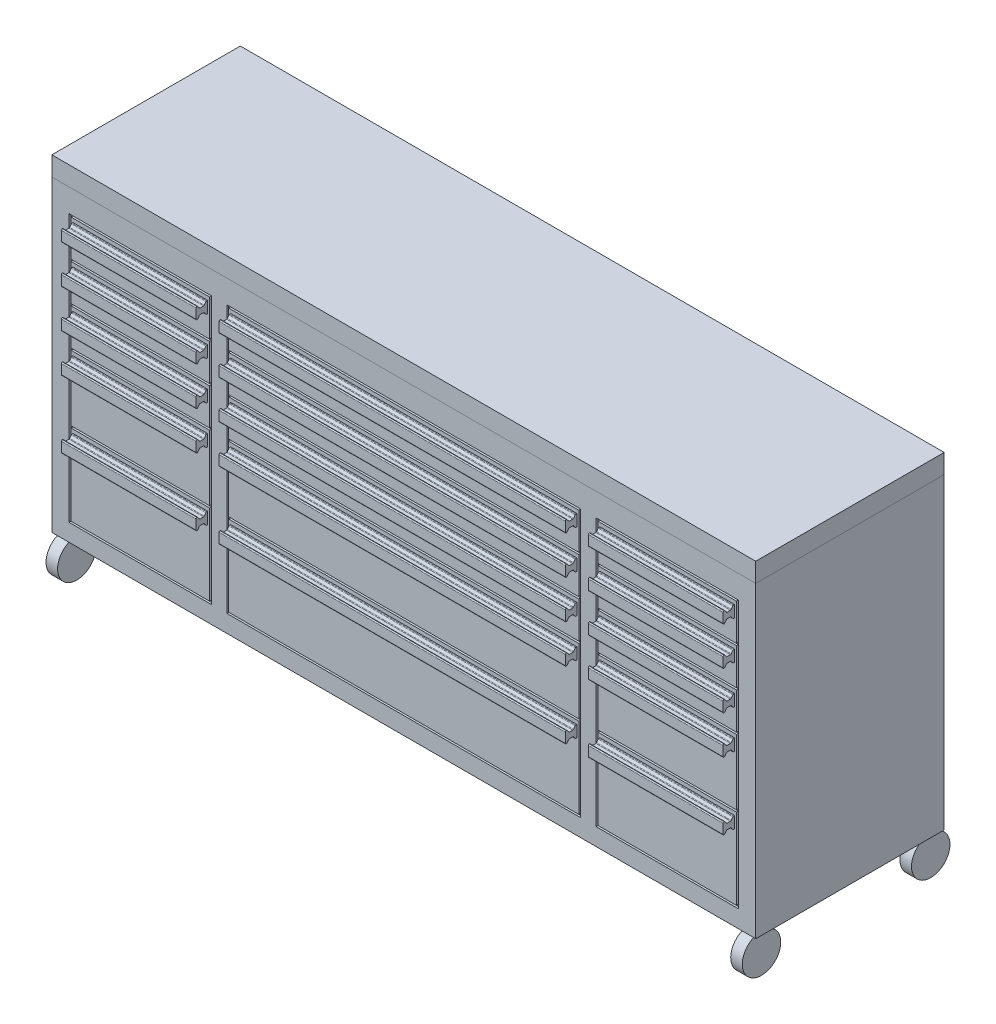
from build123d import *

# Parameters (mm, degrees)
SKETCH1_W           = 1830
SKETCH1_H           = 800
BOSS_EXTRUDE1_DEPTH = 490
SKETCH3_W           = 1830
SKETCH3_H           = 490
BOSS_EXTRUDE2_DEPTH = 50
BOSS_EXTRUDE3_DEPTH = 1830
FILLET1_R           = 2.5
CUT_EXTRUDE1_REACH  = 2078.415
SKETCH5_W           = 55
SKETCH5_H           = 30
SKETCH5_W_2         = 60
SKETCH6_W           = 370
SKETCH6_H           = 695
SKETCH6_W_2         = 360
SKETCH6_H_2         = 95
SKETCH6_H_3         = 210
SKETCH6_H_4         = 170
SKETCH6_W_3         = 910
CUT_EXTRUDE2_DEPTH  = 5
SKETCH9_W           = 30
SKETCH9_H           = 50
LPATTERN3_COUNT     = 2
LPATTERN3_PITCH     = 1780
LPATTERN3_2_COUNT   = 2
LPATTERN3_2_PITCH   = 440


with BuildPart() as part:
    # Sketch1 → Boss-Extrude1 (new body)
    with BuildSketch(Plane.XY):
        with Locations((915, 500)):
            Rectangle(SKETCH1_W, SKETCH1_H)
    extrude(amount=-BOSS_EXTRUDE1_DEPTH)

    # Sketch4 → Boss-Extrude3 (add)
    with BuildSketch(Plane.ZY):
        Polygon((3.75, 350), (0, 350), (0, 320), (3.75, 320), (9.375, 327.5), (20.625, 327.5), (26.25, 320), (30, 320), (30, 350), (26.25, 350), (20.625, 342.5), (9.375, 342.5), align=None)
        Polygon((3.75, 525), (0, 525), (0, 495), (3.75, 495), (9.375, 502.5), (20.625, 502.5), (26.25, 495), (30, 495), (30, 525), (26.25, 525), (20.625, 517.5), (9.375, 517.5), align=None)
        Polygon((3.75, 625), (0, 625), (0, 595), (3.75, 595), (9.375, 602.5), (20.625, 602.5), (26.25, 595), (30, 595), (30, 625), (26.25, 625), (20.625, 617.5), (9.375, 617.5), align=None)
        Polygon((3.75, 725), (0, 725), (0, 695), (3.75, 695), (9.375, 702.5), (20.625, 702.5), (26.25, 695), (30, 695), (30, 725), (26.25, 725), (20.625, 717.5), (9.375, 717.5), align=None)
        Polygon((3.75, 825), (0, 825), (0, 810), (30, 810), (30, 825), (26.25, 825), (20.625, 817.5), (9.375, 817.5), align=None)
        Polygon((30, 810), (0, 810), (0, 795), (3.75, 795), (9.375, 802.5), (20.625, 802.5), (26.25, 795), (30, 795), align=None)
    extrude(amount=-BOSS_EXTRUDE3_DEPTH)

    # Fillet1
    fillet1_edges = [part.edges().sort_by_distance(p)[0] for p in [
        (915, 795, 3.75),
        (915, 802.5, 9.375),
        (915, 802.5, 20.625),
        (915, 795, 26.25),
        (915, 795, 30),
        (915, 825, 30),
        (915, 825, 26.25),
        (915, 817.5, 20.625),
        (915, 817.5, 9.375),
        (915, 825, 3.75),
        (915, 327.5, 9.375),
        (915, 327.5, 20.625),
        (915, 320, 26.25),
        (915, 320, 30),
        (915, 350, 30),
        (915, 350, 26.25),
        (915, 342.5, 20.625),
        (915, 342.5, 9.375),
        (915, 350, 3.75),
        (915, 320, 3.75),
        (915, 517.5, 20.625),
        (915, 525, 26.25),
        (915, 525, 30),
        (915, 495, 30),
        (915, 495, 26.25),
        (915, 502.5, 20.625),
        (915, 502.5, 9.375),
        (915, 495, 3.75),
        (915, 525, 3.75),
        (915, 517.5, 9.375),
        (915, 617.5, 20.625),
        (915, 625, 26.25),
        (915, 625, 30),
        (915, 595, 30),
        (915, 595, 26.25),
        (915, 602.5, 20.625),
        (915, 602.5, 9.375),
        (915, 595, 3.75),
        (915, 625, 3.75),
        (915, 617.5, 9.375),
        (915, 725, 26.25),
        (915, 725, 30),
        (915, 695, 30),
        (915, 695, 26.25),
        (915, 702.5, 20.625),
        (915, 702.5, 9.375),
        (915, 695, 3.75),
        (915, 725, 3.75),
        (915, 717.5, 9.375),
    ]]
    fillet(fillet1_edges, radius=FILLET1_R - 0.0001)  # a hair under: the kernel refuses the full size

    # Cut-Extrude1: up to this face of the body (flat: up to its plane)
    cut_extrude1_end = Plane(part.part.faces().sort_by_distance((915, 100, -245))[0])
    # Sketch5 → Cut-Extrude1 (cut, up to the picked face)
    with BuildSketch(Plane(origin=(0, 950, 0), x_dir=(1, 0, 0), z_dir=(0, 1, 0)), mode=Mode.PRIVATE) as cut_extrude1_sk1:
        with Locations((27.5, -15)):
            Rectangle(SKETCH5_W, SKETCH5_H)
    cut_extrude1_tool1 = split(extrude(cut_extrude1_sk1.sketch, amount=-CUT_EXTRUDE1_REACH, mode=Mode.PRIVATE), bisect_by=cut_extrude1_end, keep=Keep.BOTH, mode=Mode.PRIVATE)
    # Sketch5 → Cut-Extrude1 (cut, up to the picked face)
    with BuildSketch(Plane(origin=(0, 950, 0), x_dir=(1, 0, 0), z_dir=(0, 1, 0)), mode=Mode.PRIVATE) as cut_extrude1_sk2:
        with Locations((435, -15)):
            Rectangle(SKETCH5_W_2, SKETCH5_H)
    cut_extrude1_tool2 = split(extrude(cut_extrude1_sk2.sketch, amount=-CUT_EXTRUDE1_REACH, mode=Mode.PRIVATE), bisect_by=cut_extrude1_end, keep=Keep.BOTH, mode=Mode.PRIVATE)
    # Sketch5 → Cut-Extrude1 (cut, up to the picked face)
    with BuildSketch(Plane(origin=(0, 950, 0), x_dir=(1, 0, 0), z_dir=(0, 1, 0)), mode=Mode.PRIVATE) as cut_extrude1_sk3:
        with Locations((1395, -15)):
            Rectangle(SKETCH5_W_2, SKETCH5_H)
    cut_extrude1_tool3 = split(extrude(cut_extrude1_sk3.sketch, amount=-CUT_EXTRUDE1_REACH, mode=Mode.PRIVATE), bisect_by=cut_extrude1_end, keep=Keep.BOTH, mode=Mode.PRIVATE)
    # Sketch5 → Cut-Extrude1 (cut, up to the picked face)
    with BuildSketch(Plane(origin=(0, 950, 0), x_dir=(1, 0, 0), z_dir=(0, 1, 0)), mode=Mode.PRIVATE) as cut_extrude1_sk4:
        with Locations((1802.5, -15)):
            Rectangle(SKETCH5_W, SKETCH5_H)
    cut_extrude1_tool4 = split(extrude(cut_extrude1_sk4.sketch, amount=-CUT_EXTRUDE1_REACH, mode=Mode.PRIVATE), bisect_by=cut_extrude1_end, keep=Keep.BOTH, mode=Mode.PRIVATE)
    add(cut_extrude1_tool1.solids().sort_by(Axis((27.5, 950, 15), (0, -1, 0)))[0], mode=Mode.SUBTRACT)
    add(cut_extrude1_tool2.solids().sort_by(Axis((435, 950, 15), (0, -1, 0)))[0], mode=Mode.SUBTRACT)
    add(cut_extrude1_tool3.solids().sort_by(Axis((1395, 950, 15), (0, -1, 0)))[0], mode=Mode.SUBTRACT)
    add(cut_extrude1_tool4.solids().sort_by(Axis((1802.5, 950, 15), (0, -1, 0)))[0], mode=Mode.SUBTRACT)

    # Sketch6 → Cut-Extrude2 (cut)
    # profile 1 of 3: a face of its own
    with BuildSketch(Plane.XY):
        with Locations((230, 492.5)):
            Rectangle(SKETCH6_W, SKETCH6_H)
        with Locations((230, 787.5)):
            Rectangle(SKETCH6_W_2, SKETCH6_H_2, mode=Mode.SUBTRACT)
        with Locations((230, 255)):
            Rectangle(SKETCH6_W_2, SKETCH6_H_3, mode=Mode.SUBTRACT)
        with Locations((230, 687.5)):
            Rectangle(SKETCH6_W_2, SKETCH6_H_2, mode=Mode.SUBTRACT)
        with Locations((230, 587.5)):
            Rectangle(SKETCH6_W_2, SKETCH6_H_2, mode=Mode.SUBTRACT)
        with Locations((230, 450)):
            Rectangle(SKETCH6_W_2, SKETCH6_H_4, mode=Mode.SUBTRACT)
    # profile 2 of 3: a face of its own
    with BuildSketch(Plane.XY):
        Polygon((455, 840), (455, 740), (455, 735), (455, 640), (455, 635), (455, 540), (455, 535), (455, 365), (455, 360), (455, 145), (1375, 145), (1375, 360), (1375, 365), (1375, 535), (1375, 540), (1375, 635), (1375, 640), (1375, 735), (1375, 740), (1375, 840), align=None)
        with Locations((915, 787.5)):
            Rectangle(SKETCH6_W_3, SKETCH6_H_2, mode=Mode.SUBTRACT)
        with Locations((915, 255)):
            Rectangle(SKETCH6_W_3, SKETCH6_H_3, mode=Mode.SUBTRACT)
        with Locations((915, 687.5)):
            Rectangle(SKETCH6_W_3, SKETCH6_H_2, mode=Mode.SUBTRACT)
        with Locations((915, 587.5)):
            Rectangle(SKETCH6_W_3, SKETCH6_H_2, mode=Mode.SUBTRACT)
        with Locations((915, 450)):
            Rectangle(SKETCH6_W_3, SKETCH6_H_4, mode=Mode.SUBTRACT)
    # profile 3 of 3: a face of its own
    with BuildSketch(Plane.XY):
        Polygon((1785, 840), (1785, 740), (1785, 735), (1785, 640), (1785, 635), (1785, 540), (1785, 535), (1785, 365), (1785, 360), (1785, 145), (1415, 145), (1415, 360), (1415, 365), (1415, 535), (1415, 540), (1415, 635), (1415, 640), (1415, 735), (1415, 740), (1415, 840), align=None)
        with Locations((1600, 787.5)):
            Rectangle(SKETCH6_W_2, SKETCH6_H_2, mode=Mode.SUBTRACT)
        with Locations((1600, 255)):
            Rectangle(SKETCH6_W_2, SKETCH6_H_3, mode=Mode.SUBTRACT)
        with Locations((1600, 687.5)):
            Rectangle(SKETCH6_W_2, SKETCH6_H_2, mode=Mode.SUBTRACT)
        with Locations((1600, 587.5)):
            Rectangle(SKETCH6_W_2, SKETCH6_H_2, mode=Mode.SUBTRACT)
        with Locations((1600, 450)):
            Rectangle(SKETCH6_W_2, SKETCH6_H_4, mode=Mode.SUBTRACT)
    extrude(amount=-CUT_EXTRUDE2_DEPTH, mode=Mode.SUBTRACT)


with BuildPart() as body_2:
    # Sketch3 → Boss-Extrude2 (new body)
    with BuildSketch(Plane(origin=(0, 900, 0), x_dir=(1, 0, 0), z_dir=(0, 1, 0))):
        with Locations((915, 245)):
            Rectangle(SKETCH3_W, SKETCH3_H)
    extrude(amount=BOSS_EXTRUDE2_DEPTH)


with BuildPart() as body_3:
    # Sketch9 → Revolve1 (revolve)
    with BuildSketch(Plane.XY.offset(-25), mode=Mode.PRIVATE) as revolve1_sk:
        with Locations((25, 75)):
            Rectangle(SKETCH9_W, SKETCH9_H)
    revolve(revolve1_sk.sketch.rotate(Axis((10, 50, -25), (1, 0, 0)), 180), axis=Axis((10, 50, -25), (1, 0, 0)))


with BuildPart() as lpattern3_1:
    # LPattern3: pattern copy
    add(body_3.part.moved(Location(Vector(1, 0, 0) * (1 * LPATTERN3_PITCH))))


with BuildPart() as lpattern3_2_1:
    # LPattern3 2: pattern copy
    add(body_3.part.moved(Location(Vector(0, 0, -1) * (1 * LPATTERN3_2_PITCH))))


with BuildPart() as lpattern3_2_2:
    # LPattern3 2: pattern copy
    add(lpattern3_1.part.moved(Location(Vector(0, 0, -1) * (1 * LPATTERN3_2_PITCH))))


solid = Compound([part.part, body_2.part, body_3.part, lpattern3_1.part, lpattern3_2_1.part, lpattern3_2_2.part])
